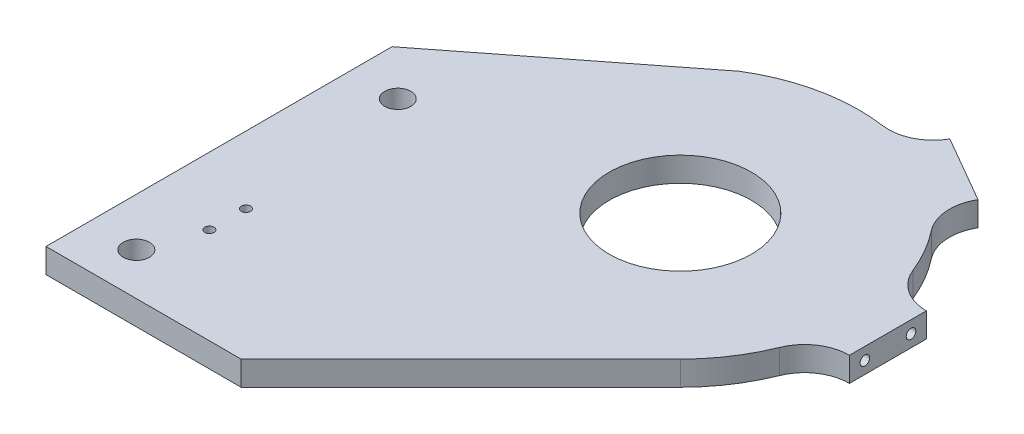
from build123d import *

# Parameters (mm, degrees)
BASE_FLANGE1_DEPTH                   = 6.35
SKETCH8_R                            = 3.4
CUT_EXTRUDE1_DEPTH                   = 183.851914127
SKETCH9_R                            = 18.5
CUT_EXTRUDE2_DEPTH                   = 183.851914127
SKETCH11_R                           = 1.2
CUT_EXTRUDE4_DEPTH                   = 183.851914127
BOSS_EXTRUDE2_START                  = -6.35
BOSS_EXTRUDE2_DEPTH                  = 6.35
TAP_DRILL_FOR_M3X0_5_TAP2_AT_2_COUNT = 2
TAP_DRILL_FOR_M3X0_5_TAP2_AT_2_PITCH = 12
CIRPATTERN3_COUNT                    = 2
CIRPATTERN3_ANGLE                    = 60


# Sheet-metal steps are written as plain solids
with BuildPart() as part:
    # Sketch2 → Base-Flange1 (new body)
    with BuildSketch(Plane(origin=(0, 0, 0), x_dir=(1, 0, 0), z_dir=(0, 1, 0))):
        with BuildLine():
            Line((0, 0), (50.76093065, 0))
            Line((50.76093065, 0), (107.880465325, 57.119534675))
            ThreePointArc((107.880465325, 57.119534675), (111.537953618, 118.761570635), (50.76093065, 129.682710556))
            Line((50.76093065, 129.682710556), (0, 90))
            Line((0, 90), (0, 0))
        make_face()
    extrude(amount=-BASE_FLANGE1_DEPTH)

    # Sketch8 → Cut-Extrude1 (cut, through all)
    with BuildSketch(Plane(origin=(0, 0, 0), x_dir=(1, 0, 0), z_dir=(0, 1, 0))):
        with Locations(Location((12.5, 79, 0), (0, 0, 270))):
            Circle(SKETCH8_R)
        with Locations(Location((12.5, 11, 0), (0, 0, 90))):
            Circle(SKETCH8_R)
    extrude(amount=-CUT_EXTRUDE1_DEPTH, mode=Mode.SUBTRACT)

    # Sketch9 → Cut-Extrude2 (cut, through all)
    with BuildSketch(Plane(origin=(0, 0, 0), x_dir=(1, 0, 0), z_dir=(0, 1, 0))):
        with Locations(Location((75, 90, 0), (0, 0, 270))):
            Circle(SKETCH9_R)
    extrude(amount=-CUT_EXTRUDE2_DEPTH, mode=Mode.SUBTRACT)

    # Sketch11 → Cut-Extrude4 (cut, through all)
    with BuildSketch(Plane(origin=(0, 0, 0), x_dir=(1, 0, 0), z_dir=(0, 1, 0))):
        with Locations(Location((17.5, 25, 0), (0, 0, 270))):
            Circle(SKETCH11_R)
        with Locations(Location((17.5, 34.5, 0), (0, 0, 270))):
            Circle(SKETCH11_R)
    extrude(amount=-CUT_EXTRUDE4_DEPTH, mode=Mode.SUBTRACT)

    # Sketch15 → Boss-Extrude2 (add)
    with BuildSketch(Plane.XZ.offset(6.35).offset(BOSS_EXTRUDE2_START)):
        with BuildLine():
            Line((129, -100), (129, -80))
            ThreePointArc((129, -80), (122.450687881, -77.994187792), (118.147884423, -72.66477373))
            ThreePointArc((118.147884423, -72.66477373), (121.5, -90), (118.147884423, -107.33522627))
            ThreePointArc((118.147884423, -107.33522627), (122.450687881, -102.005812208), (129, -100))
        make_face()
    boss_extrude2 = extrude(amount=BOSS_EXTRUDE2_DEPTH)

    # Sketch17 → Tap Drill for M3x0.5 Tap2 (revolve, cut)
    with BuildSketch(Plane(origin=(129, -3.175, -84), x_dir=(0, 0, -1), z_dir=(0, 1, 0))):
        Polygon((0, 0), (0, 5.751075774), (1.25, 5), (1.25, 0), align=None)
    tap_drill_for_m3x0_5_tap2 = revolve(axis=Axis((135.35, -3.175, -84), (-1, 0, 0)), mode=Mode.SUBTRACT)

    # Tap Drill for M3x0.5 Tap2 at 2: Tap Drill for M3x0.5 Tap2 ×2
    with Locations(*[(0, 0, -i * TAP_DRILL_FOR_M3X0_5_TAP2_AT_2_PITCH) for i in range(1, TAP_DRILL_FOR_M3X0_5_TAP2_AT_2_COUNT)]):
        add(tap_drill_for_m3x0_5_tap2, mode=Mode.SUBTRACT)

    # CirPattern3: Boss-Extrude2, Tap Drill for M3x0.5 Tap2 ×2 about axis
    cirpattern3_axis = Axis((75, 0, -90), (0, 1, 0))
    add([boss_extrude2.rotate(cirpattern3_axis, i * CIRPATTERN3_ANGLE / (CIRPATTERN3_COUNT - 1)) for i in range(1, CIRPATTERN3_COUNT)])
    add([tap_drill_for_m3x0_5_tap2.rotate(cirpattern3_axis, i * CIRPATTERN3_ANGLE / (CIRPATTERN3_COUNT - 1)) for i in range(1, CIRPATTERN3_COUNT)], mode=Mode.SUBTRACT)

    # CirPattern3 copy 1 sketch → CirPattern3 copy 1 (revolve, cut)
    with BuildSketch(Plane(origin=(96.803847577, -3.175, -139.765371804), x_dir=(-0.8660254037844399, 0, -0.4999999999999978), z_dir=(0, 1, 0))):
        Polygon((0, 0), (0, 5.751075774), (1.25, 5), (1.25, 0), align=None)
    revolve(axis=Axis((99.978847577, -3.175, -145.264633118), (-0.4999999999999978, 0, 0.8660254037844399)), mode=Mode.SUBTRACT)


solid = part.part
